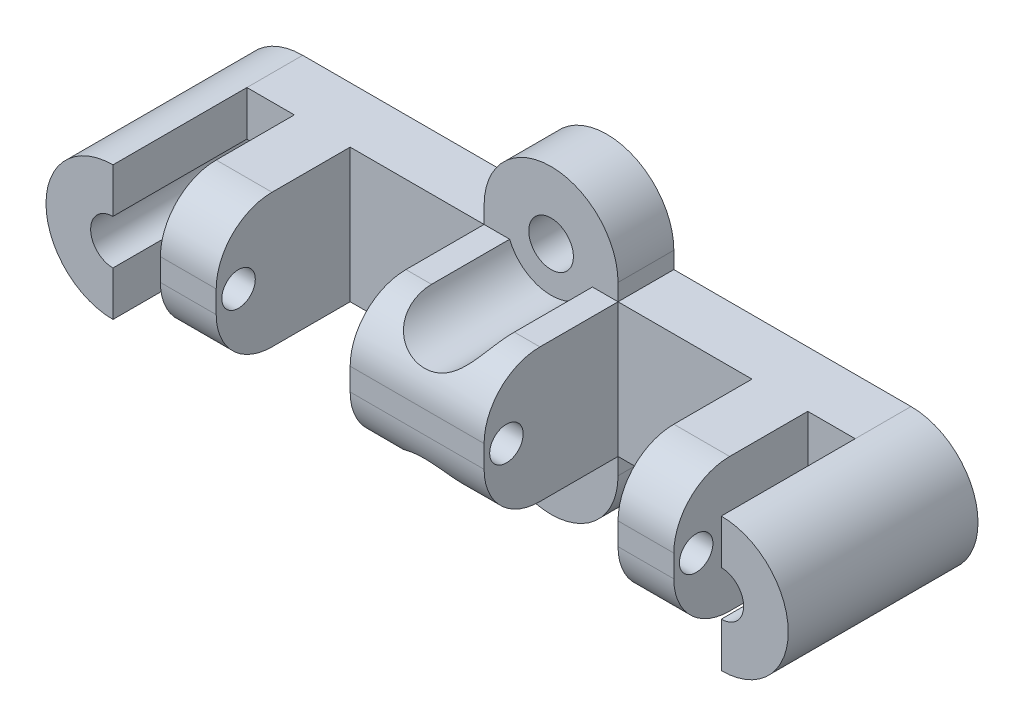
from build123d import *

# Parameters (mm, degrees)
BOSS_EXTRUDE1_DEPTH          = 5
BOSS_EXTRUDE2_START          = 12
BOSS_EXTRUDE2_DEPTH          = 12
BOSS_EXTRUDE3_START          = 12
BOSS_EXTRUDE3_DEPTH          = 12
SKETCH4_W                    = 4.25
SKETCH4_H                    = 12
CUT_EXTRUDE1_DEPTH           = 44.425942707
SKETCH5_W                    = 4.25
SKETCH5_H                    = 12
CUT_EXTRUDE2_DEPTH           = 44.425942707
BOSS_EXTRUDE4_REACH          = 75.667
F_3_0_3_DIAMETER_HOLE1_D     = 3
F_3_0_3_DIAMETER_HOLE1_DEPTH = 12
SKETCH9_W                    = 1.5
SKETCH9_H                    = 5
F_3_0_3_DIAMETER_HOLE3_D     = 3
F_3_0_3_DIAMETER_HOLE3_DEPTH = 5
F_4_0_4_DIAMETER_HOLE1_D     = 4
F_4_0_4_DIAMETER_HOLE1_DEPTH = 17
FILLET1_R                    = 5
SKETCH15_W                   = 102.81130979
SKETCH15_H                   = 78.647232544
CUT_EXTRUDE3_DEPTH           = 10


with BuildPart() as part:
    # Sketch1 → Boss-Extrude1 (new body)
    with BuildSketch(Plane.XY.offset(8)):
        with BuildLine():
            Line((-6, 57.5), (-6, 56))
            Line((-6, 56), (-27.25, 56))
            ThreePointArc((-27.25, 56), (-33.25, 50), (-27.25, 44))
            Line((-27.25, 44), (-6, 44))
            Line((-6, 44), (-6, 42.5))
            ThreePointArc((-6, 42.5), (0, 36.5), (6, 42.5))
            Line((6, 42.5), (6, 44))
            Line((6, 44), (27.25, 44))
            ThreePointArc((27.25, 44), (33.25, 50), (27.25, 56))
            Line((27.25, 56), (6, 56))
            Line((6, 56), (6, 57.5))
            ThreePointArc((6, 57.5), (0, 63.5), (-6, 57.5))
        make_face()
    extrude(amount=-BOSS_EXTRUDE1_DEPTH)

    # Sketch2 → Boss-Extrude2 (add)
    with BuildSketch(Plane.XY.offset(8).offset(BOSS_EXTRUDE2_START)):
        with BuildLine():
            Line((27.25, 44), (18, 44))
            Line((18, 44), (18, 56))
            Line((18, 56), (27.25, 56))
            ThreePointArc((27.25, 56), (33.25, 50), (27.25, 44))
        make_face()
    extrude(amount=-BOSS_EXTRUDE2_DEPTH)

    # Sketch3 → Boss-Extrude3 (add)
    with BuildSketch(Plane.XY.offset(8).offset(BOSS_EXTRUDE3_START)):
        with BuildLine():
            Line((-27.25, 56), (-18, 56))
            Line((-18, 56), (-18, 44))
            Line((-18, 44), (-27.25, 44))
            ThreePointArc((-27.25, 44), (-33.25, 50), (-27.25, 56))
        make_face()
    extrude(amount=-BOSS_EXTRUDE3_DEPTH)

    # Sketch4 → Cut-Extrude1 (cut, through all)
    with BuildSketch(Plane(origin=(0, 56, 0), x_dir=(-1, 0, 0), z_dir=(0, 1, 0))):
        with Locations((-25.125, 14)):
            Rectangle(SKETCH4_W, SKETCH4_H)
    extrude(amount=-CUT_EXTRUDE1_DEPTH, mode=Mode.SUBTRACT)

    # Sketch5 → Cut-Extrude2 (cut, through all)
    with BuildSketch(Plane(origin=(0, 56, 0), x_dir=(-1, 0, 0), z_dir=(0, 1, 0))):
        with Locations((25.125, 14)):
            Rectangle(SKETCH5_W, SKETCH5_H)
    extrude(amount=-CUT_EXTRUDE2_DEPTH, mode=Mode.SUBTRACT)

    # Sketch6 → Boss-Extrude4 (add, up to next)
    with BuildSketch(Plane.XY.offset(20), mode=Mode.PRIVATE) as boss_extrude4_sk1:
        with BuildLine():
            Line((6, 44), (6, 56))
            Line((6, 56), (3.708099244, 56))
            ThreePointArc((3.708099244, 56), (0, 53.5), (-3.708099244, 56))
            Line((-3.708099244, 56), (-6, 56))
            Line((-6, 56), (-6, 44))
            Line((-6, 44), (-3.708099244, 44))
            ThreePointArc((-3.708099244, 44), (-0.109747314, 46.498494157), (3.620236982, 44.201142026))
            Line((3.620236982, 44.201142026), (6, 44))
        make_face()
    boss_extrude4_tool1 = extrude(boss_extrude4_sk1.sketch, amount=-BOSS_EXTRUDE4_REACH, mode=Mode.PRIVATE) - part.part
    add(boss_extrude4_tool1.solids().sort_by_distance((-0.008751, 50.011684, 20))[0])

    # Ø3.0 (3) Diameter Hole1
    with Locations(Plane.ZY.offset(6)):
        with Locations((18, 50)):
            Hole(F_3_0_3_DIAMETER_HOLE1_D / 2, depth=F_3_0_3_DIAMETER_HOLE1_DEPTH)

    # Sketch9 → Ø3.0 (3) Diameter Hole2 (revolve, cut)
    with BuildSketch(Plane(origin=(23, 50, 18), x_dir=(0, 0, -1), z_dir=(0, 1, 0))):
        with Locations((0.75, 2.5)):
            Rectangle(SKETCH9_W, SKETCH9_H)
    revolve(axis=Axis((29.35, 50, 18), (-1, 0, 0)), mode=Mode.SUBTRACT)

    # Ø3.0 (3) Diameter Hole3
    with Locations(Plane(origin=(-18, 0, 0), x_dir=(0, 0, -1), z_dir=(1, 0, 0))):
        with Locations((-18, 50)):
            Hole(F_3_0_3_DIAMETER_HOLE3_D / 2, depth=F_3_0_3_DIAMETER_HOLE3_DEPTH)

    # Ø4.0 (4) Diameter Hole1
    with Locations(Plane(origin=(0, 0, 3), x_dir=(-1, 0, 0), z_dir=(0, 0, -1))):
        with Locations((0, 57.5), (-27.25, 50), (27.25, 50), (0, 42.5)):
            Hole(F_4_0_4_DIAMETER_HOLE1_D / 2, depth=F_4_0_4_DIAMETER_HOLE1_DEPTH)

    # Fillet1
    # the kernel refuses this fillet: 5 mm, written as the material it takes off along each edge
    with BuildSketch(Plane(origin=(-35.5, 56, 20), x_dir=(0, 0, -1), z_dir=(1, 0, 0))) as fillet1_piece_1_section:
        with BuildLine():
            CenterArc((FILLET1_R, -FILLET1_R), FILLET1_R, 90, 90)
            Line((0, -FILLET1_R), (0, 0))
            Line((0, 0), (FILLET1_R, 0))
        make_face()
    fillet1_piece_1 = extrude(amount=30, mode=Mode.PRIVATE)
    fillet1_piece_1 = split(fillet1_piece_1, bisect_by=Plane(origin=(-27.25, 53.041631107, 19.755841734), z_dir=(1, 0, 0)), keep=Keep.TOP, mode=Mode.PRIVATE)
    add(fillet1_piece_1, mode=Mode.SUBTRACT)
    with BuildSketch(Plane(origin=(35.5, 44, 20), x_dir=(0, 0, -1), z_dir=(-1, 0, 0))) as fillet1_piece_2_section:
        with BuildLine():
            CenterArc((FILLET1_R, -FILLET1_R), FILLET1_R, 90, 90)
            Line((0, -FILLET1_R), (0, 0))
            Line((0, 0), (FILLET1_R, 0))
        make_face()
    fillet1_piece_2 = extrude(amount=30, mode=Mode.PRIVATE)
    fillet1_piece_2 = split(fillet1_piece_2, bisect_by=Plane(origin=(27.25, 46.958368888, 19.755841732), z_dir=(-1, 0, 0)), keep=Keep.TOP, mode=Mode.PRIVATE)
    add(fillet1_piece_2, mode=Mode.SUBTRACT)
    with BuildSketch(Plane(origin=(5.5, 56, 20), x_dir=(0, 0, -1), z_dir=(1, 0, 0))) as fillet1_piece_3_section:
        with BuildLine():
            CenterArc((FILLET1_R, -FILLET1_R), FILLET1_R, 90, 90)
            Line((0, -FILLET1_R), (0, 0))
            Line((0, 0), (FILLET1_R, 0))
        make_face()
    fillet1_piece_3 = extrude(amount=30, mode=Mode.PRIVATE)
    fillet1_piece_3 = split(fillet1_piece_3, bisect_by=Plane(origin=(27.25, 54.883160305, 18.883160305), z_dir=(-1, 0, 0)), keep=Keep.TOP, mode=Mode.PRIVATE)
    add(fillet1_piece_3, mode=Mode.SUBTRACT)
    with BuildSketch(Plane(origin=(-18.5, 44, 20), x_dir=(0, 1, 0), z_dir=(1, 0, 0))) as fillet1_piece_4:
        with BuildLine():
            CenterArc((FILLET1_R, -FILLET1_R), FILLET1_R, 90, 90)
            Line((0, -FILLET1_R), (0, 0))
            Line((0, 0), (FILLET1_R, 0))
        make_face()
    extrude(amount=27.291900756, mode=Mode.SUBTRACT)
    with BuildSketch(Plane(origin=(18.5, 56, 20), x_dir=(0, 0, -1), z_dir=(-1, 0, 0))) as fillet1_piece_5:
        with BuildLine():
            CenterArc((FILLET1_R, FILLET1_R), FILLET1_R, 180, 90)
            Line((0, FILLET1_R), (0, 0))
            Line((0, 0), (FILLET1_R, 0))
        make_face()
    extrude(amount=27.291900756, mode=Mode.SUBTRACT)
    with BuildSketch(Plane(origin=(-5.5, 44, 20), x_dir=(0, 1, 0), z_dir=(-1, 0, 0))) as fillet1_piece_6_section:
        with BuildLine():
            CenterArc((FILLET1_R, FILLET1_R), FILLET1_R, 180, 90)
            Line((0, FILLET1_R), (0, 0))
            Line((0, 0), (FILLET1_R, 0))
        make_face()
    fillet1_piece_6 = extrude(amount=30, mode=Mode.PRIVATE)
    fillet1_piece_6 = split(fillet1_piece_6, bisect_by=Plane(origin=(-27.25, 45.116839695, 18.883160305), z_dir=(1, 0, 0)), keep=Keep.TOP, mode=Mode.PRIVATE)
    add(fillet1_piece_6, mode=Mode.SUBTRACT)

    # Sketch15 → Cut-Extrude3 (cut)
    with BuildSketch(Plane(origin=(0, 0, 3), x_dir=(-1, 0, 0), z_dir=(0, 0, -1))):
        with Locations((1.036291242, 56.487506321)):
            Rectangle(SKETCH15_W, SKETCH15_H)
    extrude(amount=CUT_EXTRUDE3_DEPTH, mode=Mode.SUBTRACT)


solid = part.part
